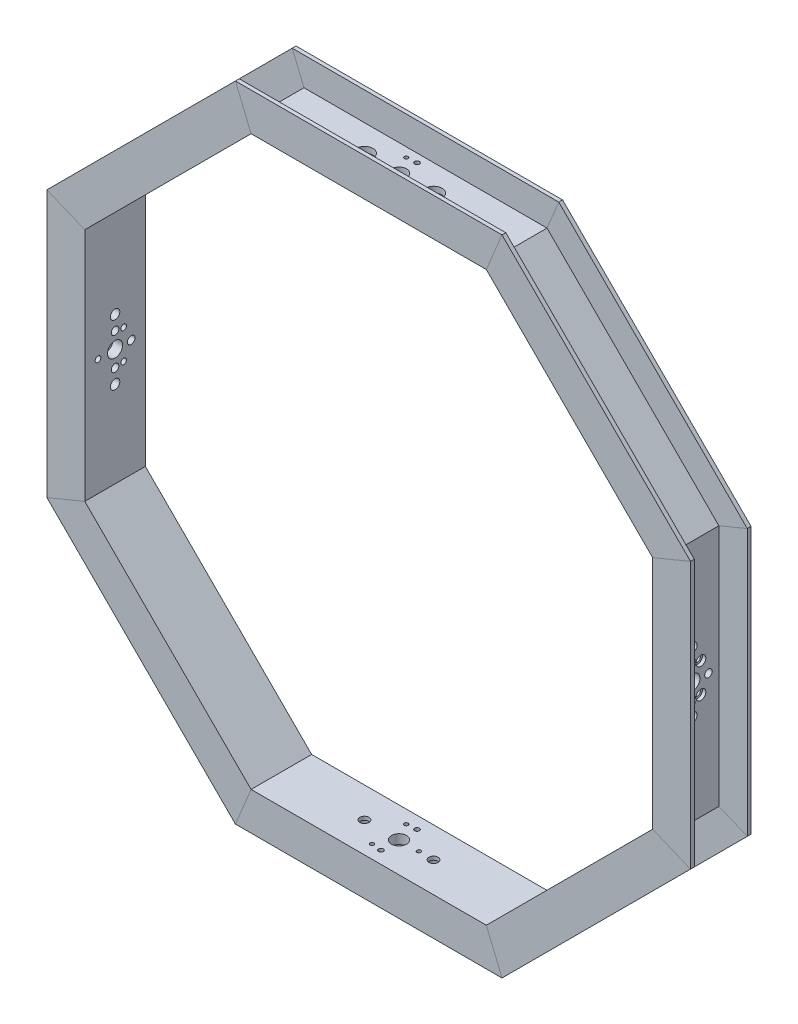
from build123d import *

# Parameters (mm, degrees)
RESSALTO_EXTRUS_O1_DEPTH                     = 32
RESSALTO_EXTRUS_O2_DEPTH                     = 2
CORTE_EXTRUS_O2_REACH                        = 370.17
ESBO_O2_R                                    = 4
ESBO_O2_R_2                                  = 2
ESBO_O2_R_3                                  = 1.5
ESBO_O2_R_4                                  = 2.5
ESBO_O18_R                                   = 4
ESBO_O18_R_2                                 = 1.25
ESBO_O18_R_3                                 = 1
CORTE_EXTRUS_O12_DEPTH                       = 369.169797784
RESSALTO_EXTRUS_O3_START                     = 32
RESSALTO_EXTRUS_O3_DEPTH                     = 2
DIVIDIR2_DEPTH                               = 32
DIVIDIR2_2_DEPTH                             = 2
DIVIDIR2_START                               = 30
DIVIDIR2_3_DEPTH                             = 2
DIVIDIR2_4_DEPTH                             = 32
DIVIDIR2_5_DEPTH                             = 2
DIVIDIR2_6_DEPTH                             = 2
DIVIDIR2_START_2                             = -155
DIVIDIR2_7_OUTLINE_R                         = 2
DIVIDIR2_7_OUTLINE_R_2                       = 1.5
DIVIDIR2_7_OUTLINE_R_3                       = 4
DIVIDIR2_7_OUTLINE_R_4                       = 2.5
DIVIDIR2_7_DEPTH                             = 5
DIVIDIR2_8_DEPTH                             = 32
DIVIDIR2_9_DEPTH                             = 32
DIVIDIR2_10_DEPTH                            = 2
DIVIDIR2_11_DEPTH                            = 2
DIVIDIR2_12_OUTLINE_R                        = 4
DIVIDIR2_12_OUTLINE_R_2                      = 1
DIVIDIR2_12_OUTLINE_R_3                      = 1.25
DIVIDIR2_12_DEPTH                            = 5
DIVIDIR2_13_DEPTH                            = 32
DIVIDIR2_14_DEPTH                            = 2
DIVIDIR2_15_DEPTH                            = 2
DIVIDIR2_16_DEPTH                            = 32
DIVIDIR2_17_DEPTH                            = 2
DIVIDIR2_18_DEPTH                            = 2
DIVIDIR2_START_3                             = 150
DIVIDIR2_19_OUTLINE_R                        = 2
DIVIDIR2_19_OUTLINE_R_2                      = 1.5
DIVIDIR2_19_OUTLINE_R_3                      = 4
DIVIDIR2_19_OUTLINE_R_4                      = 2.5
DIVIDIR2_19_DEPTH                            = 5
DIVIDIR2_20_DEPTH                            = 32
DIVIDIR2_21_DEPTH                            = 2
DIVIDIR2_22_DEPTH                            = 2
DIVIDIR2_23_OUTLINE_R                        = 4
DIVIDIR2_23_OUTLINE_R_2                      = 1
DIVIDIR2_23_OUTLINE_R_3                      = 1.25
DIVIDIR2_23_DEPTH                            = 5
DIVIDIR2_24_DEPTH                            = 32
DIVIDIR2_25_DEPTH                            = 2
DIVIDIR2_26_DEPTH                            = 2
REBAIXO_PARA_PARAFUSO_DE_M_QUINA_COM_2_COUNT = 2
REBAIXO_PARA_PARAFUSO_DE_M_QUINA_COM_2_PITCH = 36.5
FURO3_AT_2_COUNT                             = 2
FURO3_AT_2_PITCH                             = 15.588457268
FURO3_AT_3_COUNT                             = 2
FURO3_AT_3_PITCH                             = 15.588457268


with BuildPart() as part:
    # Esboço1 → Ressalto-extrusão1 (new body)
    with BuildSketch(Plane.XY):
        Polygon((64.203102168, -155), (155, -64.203102168), (155, 64.203102168), (64.203102168, 155), (-64.203102168, 155), (-155, 64.203102168), (-155, -64.203102168), (-64.203102168, -155), align=None)
        Polygon((150, -62.132034356), (150, 62.132034356), (62.132034356, 150), (-62.132034356, 150), (-150, 62.132034356), (-150, -62.132034356), (-62.132034356, -150), (62.132034356, -150), align=None, mode=Mode.SUBTRACT)
    extrude(amount=RESSALTO_EXTRUS_O1_DEPTH)

    # Esboço1<3> → Ressalto-extrusão2 (add)
    with BuildSketch(Plane.XY):
        Polygon((70.416305603, -170), (170, -70.416305603), (170, 70.416305603), (70.416305603, 170), (-70.416305603, 170), (-170, 70.416305603), (-170, -70.416305603), (-70.416305603, -170), align=None)
        Polygon((155, -64.203102168), (155, 64.203102168), (64.203102168, 155), (-64.203102168, 155), (-155, 64.203102168), (-155, -64.203102168), (-64.203102168, -155), (64.203102168, -155), align=None, mode=Mode.SUBTRACT)
    extrude(amount=RESSALTO_EXTRUS_O2_DEPTH)

    # Esboço2 → Corte-extrusão2 (cut, up to next)
    with BuildSketch(Plane(origin=(155, 0, 0), x_dir=(0, 0, -1), z_dir=(1, 0, 0)), mode=Mode.PRIVATE) as corte_extrus_o2_sk1:
        with Locations(Location((-16, -0.571854667, 0), (0, 0, 90))):
            Circle(ESBO_O2_R)
    corte_extrus_o2_tool1 = extrude(corte_extrus_o2_sk1.sketch, amount=-CORTE_EXTRUS_O2_REACH, mode=Mode.PRIVATE) & part.part
    # Esboço2 → Corte-extrusão2 (cut, up to next)
    with BuildSketch(Plane(origin=(155, 0, 0), x_dir=(0, 0, -1), z_dir=(1, 0, 0)), mode=Mode.PRIVATE) as corte_extrus_o2_sk2:
        with Locations(Location((-16, 7.928145333, 0), (0, 0, 90))):
            Circle(ESBO_O2_R_2)
    corte_extrus_o2_tool2 = extrude(corte_extrus_o2_sk2.sketch, amount=-CORTE_EXTRUS_O2_REACH, mode=Mode.PRIVATE) & part.part
    # Esboço2 → Corte-extrusão2 (cut, up to next)
    with BuildSketch(Plane(origin=(155, 0, 0), x_dir=(0, 0, -1), z_dir=(1, 0, 0)), mode=Mode.PRIVATE) as corte_extrus_o2_sk3:
        with Locations(Location((-25, -0.571854667, 0), (0, 0, 90))):
            Circle(ESBO_O2_R_3)
    corte_extrus_o2_tool3 = extrude(corte_extrus_o2_sk3.sketch, amount=-CORTE_EXTRUS_O2_REACH, mode=Mode.PRIVATE) & part.part
    # Esboço2 → Corte-extrusão2 (cut, up to next)
    with BuildSketch(Plane(origin=(155, 0, 0), x_dir=(0, 0, -1), z_dir=(1, 0, 0)), mode=Mode.PRIVATE) as corte_extrus_o2_sk4:
        with Locations(Location((-7.5, -0.571854667, 0), (0, 0, 90))):
            Circle(ESBO_O2_R_2)
    corte_extrus_o2_tool4 = extrude(corte_extrus_o2_sk4.sketch, amount=-CORTE_EXTRUS_O2_REACH, mode=Mode.PRIVATE) & part.part
    # Esboço2 → Corte-extrusão2 (cut, up to next)
    with BuildSketch(Plane(origin=(155, 0, 0), x_dir=(0, 0, -1), z_dir=(1, 0, 0)), mode=Mode.PRIVATE) as corte_extrus_o2_sk5:
        with Locations(Location((-16, -9.071854667, 0), (0, 0, 90))):
            Circle(ESBO_O2_R_2)
    corte_extrus_o2_tool5 = extrude(corte_extrus_o2_sk5.sketch, amount=-CORTE_EXTRUS_O2_REACH, mode=Mode.PRIVATE) & part.part
    # Esboço2 → Corte-extrusão2 (cut, up to next)
    with BuildSketch(Plane(origin=(155, 0, 0), x_dir=(0, 0, -1), z_dir=(1, 0, 0)), mode=Mode.PRIVATE) as corte_extrus_o2_sk6:
        with Locations(Location((-11.5, 7.222373967, 0), (0, 0, 90))):
            Circle(ESBO_O2_R_3)
    corte_extrus_o2_tool6 = extrude(corte_extrus_o2_sk6.sketch, amount=-CORTE_EXTRUS_O2_REACH, mode=Mode.PRIVATE) & part.part
    # Esboço2 → Corte-extrusão2 (cut, up to next)
    with BuildSketch(Plane(origin=(155, 0, 0), x_dir=(0, 0, -1), z_dir=(1, 0, 0)), mode=Mode.PRIVATE) as corte_extrus_o2_sk7:
        with Locations(Location((-11.5, -8.366083301, 0), (0, 0, 90))):
            Circle(ESBO_O2_R_3)
    corte_extrus_o2_tool7 = extrude(corte_extrus_o2_sk7.sketch, amount=-CORTE_EXTRUS_O2_REACH, mode=Mode.PRIVATE) & part.part
    # Esboço2 → Corte-extrusão2 (cut, up to next)
    with BuildSketch(Plane(origin=(155, 0, 0), x_dir=(0, 0, -1), z_dir=(1, 0, 0)), mode=Mode.PRIVATE) as corte_extrus_o2_sk8:
        with Locations(Location((-16, 15.428145333, 0), (0, 0, 90))):
            Circle(ESBO_O2_R_4)
    corte_extrus_o2_tool8 = extrude(corte_extrus_o2_sk8.sketch, amount=-CORTE_EXTRUS_O2_REACH, mode=Mode.PRIVATE) & part.part
    # Esboço2 → Corte-extrusão2 (cut, up to next)
    with BuildSketch(Plane(origin=(155, 0, 0), x_dir=(0, 0, -1), z_dir=(1, 0, 0)), mode=Mode.PRIVATE) as corte_extrus_o2_sk9:
        with Locations(Location((-16, -16.571854667, 0), (0, 0, 90))):
            Circle(ESBO_O2_R_4)
    corte_extrus_o2_tool9 = extrude(corte_extrus_o2_sk9.sketch, amount=-CORTE_EXTRUS_O2_REACH, mode=Mode.PRIVATE) & part.part
    corte_extrus_o2_1 = corte_extrus_o2_tool1.solids().sort_by_distance((155, -0.571855, 16))[0]
    add(corte_extrus_o2_1, mode=Mode.SUBTRACT)
    corte_extrus_o2_2 = corte_extrus_o2_tool2.solids().sort_by_distance((155, 7.928145, 16))[0]
    add(corte_extrus_o2_2, mode=Mode.SUBTRACT)
    corte_extrus_o2_3 = corte_extrus_o2_tool3.solids().sort_by_distance((155, -0.571855, 25))[0]
    add(corte_extrus_o2_3, mode=Mode.SUBTRACT)
    corte_extrus_o2_4 = corte_extrus_o2_tool4.solids().sort_by_distance((155, -0.571855, 7.5))[0]
    add(corte_extrus_o2_4, mode=Mode.SUBTRACT)
    corte_extrus_o2_5 = corte_extrus_o2_tool5.solids().sort_by_distance((155, -9.071855, 16))[0]
    add(corte_extrus_o2_5, mode=Mode.SUBTRACT)
    corte_extrus_o2_6 = corte_extrus_o2_tool6.solids().sort_by_distance((155, 7.222374, 11.5))[0]
    add(corte_extrus_o2_6, mode=Mode.SUBTRACT)
    corte_extrus_o2_7 = corte_extrus_o2_tool7.solids().sort_by_distance((155, -8.366083, 11.5))[0]
    add(corte_extrus_o2_7, mode=Mode.SUBTRACT)
    corte_extrus_o2_8 = corte_extrus_o2_tool8.solids().sort_by_distance((155, 15.428145, 16))[0]
    add(corte_extrus_o2_8, mode=Mode.SUBTRACT)
    corte_extrus_o2_9 = corte_extrus_o2_tool9.solids().sort_by_distance((155, -16.571855, 16))[0]
    add(corte_extrus_o2_9, mode=Mode.SUBTRACT)
    corte_extrus_o2 = corte_extrus_o2_1 + corte_extrus_o2_2 + corte_extrus_o2_3 + corte_extrus_o2_4 + corte_extrus_o2_5 + corte_extrus_o2_6 + corte_extrus_o2_7 + corte_extrus_o2_8 + corte_extrus_o2_9  # Corte-extrusão2 as one shape, for the pattern or mirror that repeats it

    # Esboço18 → Corte-extrusão12 (cut, through all)
    with BuildSketch(Plane.XZ.offset(155)):
        with Locations((0, 16)):
            Circle(ESBO_O18_R)
        with Locations((0, 25.53)):
            Circle(ESBO_O18_R_2)
        with Locations((0, 6.47)):
            Circle(ESBO_O18_R_2)
        with Locations((10.45, 16)):
            Circle(ESBO_O18_R_3)
        with Locations((-5.225, 25.04996547)):
            Circle(ESBO_O18_R_3)
        with Locations((-5.225, 6.95003453)):
            Circle(ESBO_O18_R_3)
    extrude(amount=-CORTE_EXTRUS_O12_DEPTH, mode=Mode.SUBTRACT)

    # Espelhar6: Corte-extrusão2 across plane
    add(corte_extrus_o2.mirror(Plane(origin=(0, 0, 0), x_dir=(0, 0, 1), z_dir=(1, 0, 0))), mode=Mode.SUBTRACT)

    # Esboço1<4> → Ressalto-extrusão3 (add)
    with BuildSketch(Plane.XY.offset(RESSALTO_EXTRUS_O3_START)):
        Polygon((70.416305603, -170), (170, -70.416305603), (170, 70.416305603), (70.416305603, 170), (-70.416305603, 170), (-170, 70.416305603), (-170, -70.416305603), (-70.416305603, -170), align=None)
        Polygon((155, -64.203102168), (155, 64.203102168), (64.203102168, 155), (-64.203102168, 155), (-155, 64.203102168), (-155, -64.203102168), (-64.203102168, -155), (64.203102168, -155), align=None, mode=Mode.SUBTRACT)
    extrude(amount=-RESSALTO_EXTRUS_O3_DEPTH)

    # Dividir2 8 outline → Dividir2 8 (cut)
    with BuildSketch(Plane.XY):
        Polygon((62.132034356, -150), (-62.132034356, -150), (-70.416305603, -170), (70.416305603, -170), (170, -70.416305603), (170, 70.416305603), (70.416305603, 170), (-70.416305603, 170), (-170, 70.416305603), (-170, -70.416305603), (-150, -62.132034356), (-150, 62.132034356), (-62.132034356, 150), (62.132034356, 150), (150, 62.132034356), (150, -62.132034356), align=None)
    extrude(amount=DIVIDIR2_8_DEPTH, mode=Mode.SUBTRACT)


with BuildPart() as body_2:
    # Dividir2: read off the stored shape, not the designer's step
    # Dividir2 outline → Dividir2 (new body)
    with BuildSketch(Plane.XY):
        Polygon((155, 64.203102168), (64.203102168, 155), (62.132034356, 150), (150, 62.132034356), align=None)
    extrude(amount=DIVIDIR2_DEPTH)

    # Dividir2 2 outline → Dividir2 2 (add)
    with BuildSketch(Plane.XY):
        Polygon((170, 70.416305603), (70.416305603, 170), (64.203102168, 155), (155, 64.203102168), align=None)
    extrude(amount=DIVIDIR2_2_DEPTH)

    # Dividir2 3 outline → Dividir2 3 (add)
    with BuildSketch(Plane.XY.offset(DIVIDIR2_START)):
        Polygon((170, 70.416305603), (70.416305603, 170), (64.203102168, 155), (155, 64.203102168), align=None)
    extrude(amount=DIVIDIR2_3_DEPTH)


with BuildPart() as body_3:
    # Dividir2 4 outline → Dividir2 4 (new body)
    with BuildSketch(Plane.XY):
        Polygon((-155, -64.203102168), (-150, -62.132034356), (-150, 62.132034356), (-155, 64.203102168), align=None)
    extrude(amount=DIVIDIR2_4_DEPTH)

    # Dividir2 5 outline → Dividir2 5 (add)
    with BuildSketch(Plane.XY):
        Polygon((-170, -70.416305603), (-155, -64.203102168), (-155, 64.203102168), (-170, 70.416305603), align=None)
    extrude(amount=DIVIDIR2_5_DEPTH)

    # Dividir2 6 outline → Dividir2 6 (add)
    with BuildSketch(Plane.XY.offset(DIVIDIR2_START)):
        Polygon((-170, -70.416305603), (-155, -64.203102168), (-155, 64.203102168), (-170, 70.416305603), align=None)
    extrude(amount=DIVIDIR2_6_DEPTH)

    # Dividir2 7 outline → Dividir2 7 (cut)
    with BuildSketch(Plane.YZ.offset(DIVIDIR2_START_2)):
        with Locations((-0.571854667, 7.5)):
            Circle(DIVIDIR2_7_OUTLINE_R)
        with Locations((7.222373967, 11.5)):
            Circle(DIVIDIR2_7_OUTLINE_R_2)
        with Locations((7.928145333, 16)):
            Circle(DIVIDIR2_7_OUTLINE_R)
        with Locations((-0.571854667, 16)):
            Circle(DIVIDIR2_7_OUTLINE_R_3)
        with Locations((-16.571854667, 16)):
            Circle(DIVIDIR2_7_OUTLINE_R_4)
        with Locations((15.428145333, 16)):
            Circle(DIVIDIR2_7_OUTLINE_R_4)
        with Locations((-9.071854667, 16)):
            Circle(DIVIDIR2_7_OUTLINE_R)
        with Locations((-8.366083301, 11.5)):
            Circle(DIVIDIR2_7_OUTLINE_R_2)
        with Locations((-0.571854667, 25)):
            Circle(DIVIDIR2_7_OUTLINE_R_2)
    extrude(amount=DIVIDIR2_7_DEPTH, mode=Mode.SUBTRACT)


with BuildPart() as body_4:
    # Dividir2 9 outline → Dividir2 9 (new body)
    with BuildSketch(Plane.XY):
        Polygon((64.203102168, -155), (62.132034356, -150), (-62.132034356, -150), (-64.203102168, -155), align=None)
    extrude(amount=DIVIDIR2_9_DEPTH)

    # Dividir2 10 outline → Dividir2 10 (add)
    with BuildSketch(Plane.XY):
        Polygon((70.416305603, -170), (64.203102168, -155), (-64.203102168, -155), (-70.416305603, -170), align=None)
    extrude(amount=DIVIDIR2_10_DEPTH)

    # Dividir2 11 outline → Dividir2 11 (add)
    with BuildSketch(Plane.XY.offset(DIVIDIR2_START)):
        Polygon((70.416305603, -170), (64.203102168, -155), (-64.203102168, -155), (-70.416305603, -170), align=None)
    extrude(amount=DIVIDIR2_11_DEPTH)

    # Dividir2 12 outline → Dividir2 12 (cut)
    with BuildSketch(Plane(origin=(0, 0, 0), x_dir=(1, 0, 0), z_dir=(0, 1, 0)).offset(DIVIDIR2_START_2)):
        with Locations((0, -16)):
            Circle(DIVIDIR2_12_OUTLINE_R)
        with Locations((-5.225, -6.95003453)):
            Circle(DIVIDIR2_12_OUTLINE_R_2)
        with Locations((0, -25.53)):
            Circle(DIVIDIR2_12_OUTLINE_R_3)
        with Locations((0, -6.47)):
            Circle(DIVIDIR2_12_OUTLINE_R_3)
        with Locations((10.45, -16)):
            Circle(DIVIDIR2_12_OUTLINE_R_2)
        with Locations((-5.225, -25.04996547)):
            Circle(DIVIDIR2_12_OUTLINE_R_2)
    extrude(amount=DIVIDIR2_12_DEPTH, mode=Mode.SUBTRACT)


with BuildPart() as body_5:
    # Dividir2 13 outline → Dividir2 13 (new body)
    with BuildSketch(Plane.XY):
        Polygon((155, -64.203102168), (150, -62.132034356), (62.132034356, -150), (64.203102168, -155), align=None)
    extrude(amount=DIVIDIR2_13_DEPTH)

    # Dividir2 14 outline → Dividir2 14 (add)
    with BuildSketch(Plane.XY):
        Polygon((170, -70.416305603), (155, -64.203102168), (64.203102168, -155), (70.416305603, -170), align=None)
    extrude(amount=DIVIDIR2_14_DEPTH)

    # Dividir2 15 outline → Dividir2 15 (add)
    with BuildSketch(Plane.XY.offset(DIVIDIR2_START)):
        Polygon((170, -70.416305603), (155, -64.203102168), (64.203102168, -155), (70.416305603, -170), align=None)
    extrude(amount=DIVIDIR2_15_DEPTH)


with BuildPart() as body_6:
    # Dividir2 16 outline → Dividir2 16 (new body)
    with BuildSketch(Plane.XY):
        Polygon((155, 64.203102168), (150, 62.132034356), (150, -62.132034356), (155, -64.203102168), align=None)
    extrude(amount=DIVIDIR2_16_DEPTH)

    # Dividir2 17 outline → Dividir2 17 (add)
    with BuildSketch(Plane.XY):
        Polygon((170, 70.416305603), (155, 64.203102168), (155, -64.203102168), (170, -70.416305603), align=None)
    extrude(amount=DIVIDIR2_17_DEPTH)

    # Dividir2 18 outline → Dividir2 18 (add)
    with BuildSketch(Plane.XY.offset(DIVIDIR2_START)):
        Polygon((170, 70.416305603), (155, 64.203102168), (155, -64.203102168), (170, -70.416305603), align=None)
    extrude(amount=DIVIDIR2_18_DEPTH)

    # Dividir2 19 outline → Dividir2 19 (cut)
    with BuildSketch(Plane.YZ.offset(DIVIDIR2_START_3)):
        with Locations((-0.571854667, 7.5)):
            Circle(DIVIDIR2_19_OUTLINE_R)
        with Locations((7.222373967, 11.5)):
            Circle(DIVIDIR2_19_OUTLINE_R_2)
        with Locations((7.928145333, 16)):
            Circle(DIVIDIR2_19_OUTLINE_R)
        with Locations((-0.571854667, 16)):
            Circle(DIVIDIR2_19_OUTLINE_R_3)
        with Locations((-16.571854667, 16)):
            Circle(DIVIDIR2_19_OUTLINE_R_4)
        with Locations((15.428145333, 16)):
            Circle(DIVIDIR2_19_OUTLINE_R_4)
        with Locations((-9.071854667, 16)):
            Circle(DIVIDIR2_19_OUTLINE_R)
        with Locations((-8.366083301, 11.5)):
            Circle(DIVIDIR2_19_OUTLINE_R_2)
        with Locations((-0.571854667, 25)):
            Circle(DIVIDIR2_19_OUTLINE_R_2)
    extrude(amount=DIVIDIR2_19_DEPTH, mode=Mode.SUBTRACT)

    # Esboço50 → Furo3 (revolve, cut)
    with BuildSketch(Plane(origin=(155, 7.222373967, 11.5), x_dir=(0, 0, -1), z_dir=(0, 1, 0))):
        Polygon((0, 0), (0, 325), (1.5, 325), (1.5, 1.8), (2.6, 1.8), (2.6, 0), align=None)
    furo3 = revolve(axis=Axis((45, 7.222373967, 11.5), (1, 0, 0)), mode=Mode.SUBTRACT)

    # Furo3 at 2: Furo3 ×2
    with Locations(*[Vector(0, -0.4999999999999983, 0.8660254037844396) * (i * FURO3_AT_2_PITCH) for i in range(1, FURO3_AT_2_COUNT)]):
        add(furo3, mode=Mode.SUBTRACT)

    # Furo3 at 3: Furo3 ×2
    with Locations(*[(0, -i * FURO3_AT_3_PITCH, 0) for i in range(1, FURO3_AT_3_COUNT)]):
        add(furo3, mode=Mode.SUBTRACT)


with BuildPart() as body_7:
    # Dividir2 20 outline → Dividir2 20 (new body)
    with BuildSketch(Plane.XY):
        Polygon((62.132034356, 150), (64.203102168, 155), (-64.203102168, 155), (-62.132034356, 150), align=None)
    extrude(amount=DIVIDIR2_20_DEPTH)

    # Dividir2 21 outline → Dividir2 21 (add)
    with BuildSketch(Plane.XY):
        Polygon((64.203102168, 155), (70.416305603, 170), (-70.416305603, 170), (-64.203102168, 155), align=None)
    extrude(amount=DIVIDIR2_21_DEPTH)

    # Dividir2 22 outline → Dividir2 22 (add)
    with BuildSketch(Plane.XY.offset(DIVIDIR2_START)):
        Polygon((64.203102168, 155), (70.416305603, 170), (-70.416305603, 170), (-64.203102168, 155), align=None)
    extrude(amount=DIVIDIR2_22_DEPTH)

    # Dividir2 23 outline → Dividir2 23 (cut)
    with BuildSketch(Plane(origin=(0, 0, 0), x_dir=(1, 0, 0), z_dir=(0, 1, 0)).offset(DIVIDIR2_START_3)):
        with Locations((0, -16)):
            Circle(DIVIDIR2_23_OUTLINE_R)
        with Locations((-5.225, -6.95003453)):
            Circle(DIVIDIR2_23_OUTLINE_R_2)
        with Locations((0, -25.53)):
            Circle(DIVIDIR2_23_OUTLINE_R_3)
        with Locations((0, -6.47)):
            Circle(DIVIDIR2_23_OUTLINE_R_3)
        with Locations((10.45, -16)):
            Circle(DIVIDIR2_23_OUTLINE_R_2)
        with Locations((-5.225, -25.04996547)):
            Circle(DIVIDIR2_23_OUTLINE_R_2)
    extrude(amount=DIVIDIR2_23_DEPTH, mode=Mode.SUBTRACT)

    # Esboço44 → Rebaixo para parafuso de máquina com cabeça panela de M41 (revolve, cut)
    with BuildSketch(Plane(origin=(-18.25, 155, 16.002513057), x_dir=(0, 0, 1), z_dir=(1, 0, 0))):
        Polygon((0, 0), (0, 27.442065486), (2.4, 26), (2.4, 3.1), (4.5, 3.1), (4.5, 0), align=None)
    rebaixo_para_parafuso_de_m_quina_com_cab = revolve(axis=Axis((-18.25, 161.35, 16.002513057), (0, -1, 0)), mode=Mode.SUBTRACT)

    # Rebaixo para parafuso de m_quina com 2: Rebaixo para parafuso de máquina com cabeça panela de M41 ×2
    with Locations(*[(i * REBAIXO_PARA_PARAFUSO_DE_M_QUINA_COM_2_PITCH, 0, 0) for i in range(1, REBAIXO_PARA_PARAFUSO_DE_M_QUINA_COM_2_COUNT)]):
        add(rebaixo_para_parafuso_de_m_quina_com_cab, mode=Mode.SUBTRACT)


with BuildPart() as body_8:
    # Dividir2 24 outline → Dividir2 24 (new body)
    with BuildSketch(Plane.XY):
        Polygon((-62.132034356, 150), (-64.203102168, 155), (-155, 64.203102168), (-150, 62.132034356), align=None)
    extrude(amount=DIVIDIR2_24_DEPTH)

    # Dividir2 25 outline → Dividir2 25 (add)
    with BuildSketch(Plane.XY):
        Polygon((-64.203102168, 155), (-70.416305603, 170), (-170, 70.416305603), (-155, 64.203102168), align=None)
    extrude(amount=DIVIDIR2_25_DEPTH)

    # Dividir2 26 outline → Dividir2 26 (add)
    with BuildSketch(Plane.XY.offset(DIVIDIR2_START)):
        Polygon((-64.203102168, 155), (-70.416305603, 170), (-170, 70.416305603), (-155, 64.203102168), align=None)
    extrude(amount=DIVIDIR2_26_DEPTH)


with BuildPart() as body_4_1:
    add(body_4.part)

    # Espelhar8: Rebaixo para parafuso de máquina com cabeça panela de M41 across plane
    add(rebaixo_para_parafuso_de_m_quina_com_cab.mirror(Plane.ZX), mode=Mode.SUBTRACT)

    # Espelhar8 copy 1 sketch → Espelhar8 copy 1 (revolve, cut)
    with BuildSketch(Plane(origin=(18.25, -155, 16.002513057), x_dir=(0, 0, 1), z_dir=(1, 0, 0))):
        Polygon((0, 0), (0, -27.442065486), (2.4, -26), (2.4, -3.1), (4.5, -3.1), (4.5, 0), align=None)
    revolve(axis=Axis((18.25, -161.35, 16.002513057), (0, -1, 0)), mode=Mode.SUBTRACT)


solid = Compound([part.part, body_2.part, body_3.part, body_5.part, body_6.part, body_7.part, body_8.part, body_4_1.part])
